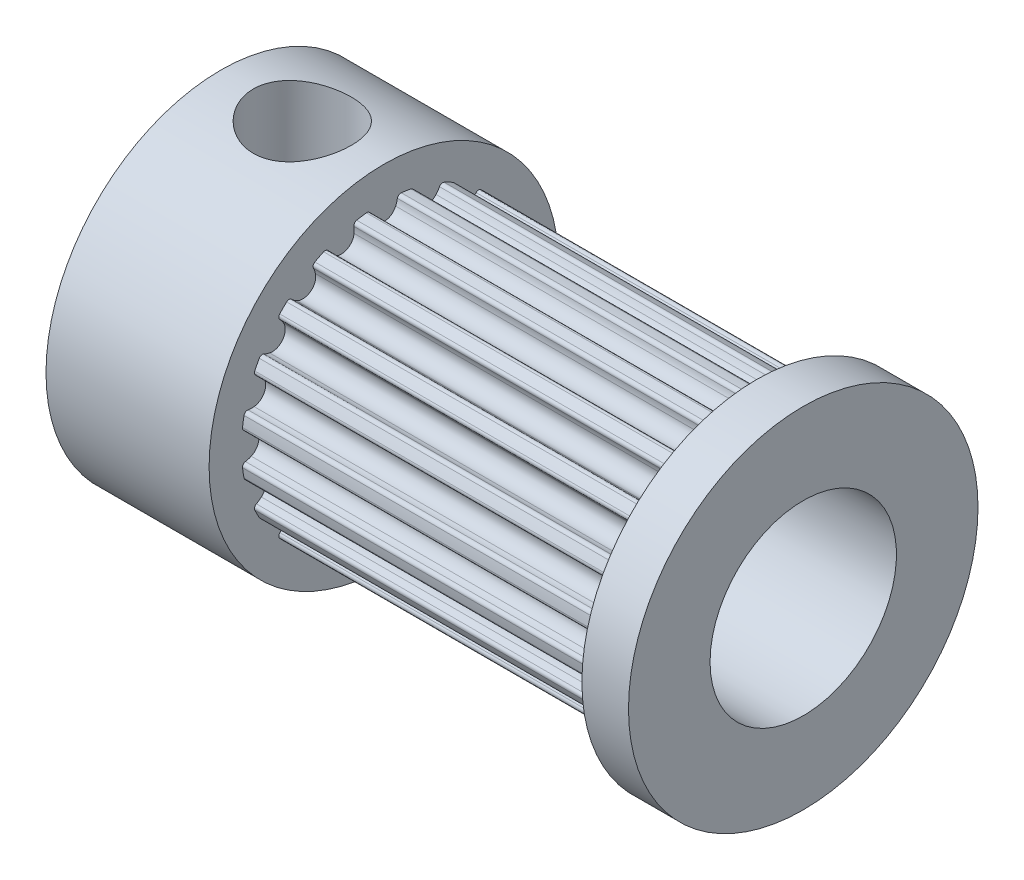
from build123d import *

# Parameters (mm, degrees)
SKETCH1_R           = 7.5
BOSS_EXTRUDE1_DEPTH = 7
BOSS_EXTRUDE2_DEPTH = 16
FILLET1_R           = 0.15
CIRPATTERN1_START   = 7
CIRPATTERN1_DEPTH   = 16
SKETCH3_R           = 7.5
BOSS_EXTRUDE3_DEPTH = 2
SKETCH4_R           = 4
CUT_EXTRUDE1_DEPTH  = 28.156951283
SKETCH5_R           = 2.1
CUT_EXTRUDE2_DEPTH  = 28.156951283
CIRPATTERN2_COUNT   = 2
CIRPATTERN2_ANGLE   = 90


# Read off the part's stored shape, not the designer's step: CirPattern1
with BuildPart() as part:
    # Sketch1 → Boss-Extrude1 (new body)
    with BuildSketch(Plane(origin=(0, 0, 0), x_dir=(0, 0, -1), z_dir=(1, 0, 0))):
        Circle(SKETCH1_R)
    extrude(amount=BOSS_EXTRUDE1_DEPTH)

    # Sketch2 → Boss-Extrude2 (add)
    with BuildSketch(Plane(origin=(7, 0, 0), x_dir=(0, 0, -1), z_dir=(1, 0, 0))):
        with BuildLine():
            ThreePointArc((-0.593569217, 6.083307806), (0, -6.1121975), (0.593569217, 6.083307806))
            ThreePointArc((0.593569217, 6.083307806), (0.570080241, 5.882675498), (0.506749498, 5.690857168))
            ThreePointArc((0.506749498, 5.690857168), (0, 5.3621975), (-0.506749498, 5.690857168))
            ThreePointArc((-0.506749498, 5.690857168), (-0.570080241, 5.882675498), (-0.593569217, 6.083307806))
        make_face()
    extrude(amount=BOSS_EXTRUDE2_DEPTH)

    # Fillet1
    fillet1_edges = [part.edges().sort_by_distance(p)[0] for p in [
        (15, 6.083307806, -0.593569217),
        (15, 6.083307806, 0.593569217),
    ]]
    fillet(fillet1_edges, radius=FILLET1_R)

    # CirPattern1 outline → CirPattern1 (cut)
    with BuildSketch(Plane.YZ.offset(CIRPATTERN1_START)):
        with BuildLine():
            ThreePointArc((6.000431601, 1.163520043), (5.813045262, 1.888772901), (5.53835106, 2.585657714))
            ThreePointArc((5.53835106, 2.585657714), (5.544301896, 2.473484624), (5.470691795, 2.38863318))
            ThreePointArc((5.470691795, 2.38863318), (5.358358343, 2.32162051), (5.255732586, 2.24051899))
            ThreePointArc((5.255732586, 2.24051899), (5.099752874, 1.657010155), (5.568921, 1.276624165))
            ThreePointArc((5.568921, 1.276624165), (5.699617259, 1.271333563), (5.82988599, 1.283147121))
            ThreePointArc((5.82988599, 1.283147121), (5.93931224, 1.257767792), (6.000431601, 1.163520043))
        make_face()
        with BuildLine():
            ThreePointArc((5.347202108, 2.960808657), (4.944871651, 3.59265955), (4.46827269, 4.170551216))
            ThreePointArc((4.46827269, 4.170551216), (4.508595662, 4.065707178), (4.464808835, 3.962261887))
            ThreePointArc((4.464808835, 3.962261887), (4.378681426, 3.863816105), (4.30614028, 3.754970872))
            ThreePointArc((4.30614028, 3.754970872), (4.338108905, 3.15182061), (4.901860043, 2.93503296))
            ThreePointArc((4.901860043, 2.93503296), (5.027794458, 2.970388664), (5.148036794, 3.021879277))
            ThreePointArc((5.148036794, 3.021879277), (5.259949985, 3.031556672), (5.347202108, 2.960808657))
        make_face()
        with BuildLine():
            ThreePointArc((4.170551216, 4.46827269), (3.59265955, 4.944871651), (2.960808657, 5.347202107))
            ThreePointArc((2.960808657, 5.347202107), (3.031556672, 5.259949985), (3.021879277, 5.148036794))
            ThreePointArc((3.021879277, 5.148036794), (2.970388664, 5.027794458), (2.93503296, 4.901860043))
            ThreePointArc((2.93503296, 4.901860043), (3.15182061, 4.338108905), (3.754970872, 4.30614028))
            ThreePointArc((3.754970872, 4.30614028), (3.863816105, 4.378681426), (3.962261887, 4.464808835))
            ThreePointArc((3.962261887, 4.464808835), (4.065707178, 4.508595662), (4.170551216, 4.46827269))
        make_face()
        with BuildLine():
            ThreePointArc((2.585657714, 5.53835106), (1.888772901, 5.813045261), (1.163520043, 6.0004316))
            ThreePointArc((1.163520043, 6.0004316), (1.257767792, 5.93931224), (1.283147121, 5.82988599))
            ThreePointArc((1.283147121, 5.82988599), (1.271333563, 5.699617259), (1.276624165, 5.568921))
            ThreePointArc((1.276624165, 5.568921), (1.657010155, 5.099752874), (2.24051899, 5.255732586))
            ThreePointArc((2.24051899, 5.255732586), (2.32162051, 5.358358343), (2.38863318, 5.470691795))
            ThreePointArc((2.38863318, 5.470691795), (2.473484624, 5.544301896), (2.585657714, 5.53835106))
        make_face()
        with BuildLine():
            ThreePointArc((0.747662019, 6.066297041), (0, 6.1121975), (-0.747662019, 6.066297041))
            ThreePointArc((-0.747662019, 6.066297041), (-0.639140162, 6.037293231), (-0.581188416, 5.941065327))
            ThreePointArc((-0.581188416, 5.941065327), (-0.552168525, 5.813521811), (-0.506749498, 5.690857168))
            ThreePointArc((-0.506749498, 5.690857168), (0, 5.3621975), (0.506749498, 5.690857168))
            ThreePointArc((0.506749498, 5.690857168), (0.552168525, 5.813521811), (0.581188416, 5.941065327))
            ThreePointArc((0.581188416, 5.941065327), (0.639140162, 6.037293231), (0.747662019, 6.066297041))
        make_face()
        with BuildLine():
            ThreePointArc((-1.163520043, 6.0004316), (-1.888772901, 5.813045261), (-2.585657714, 5.53835106))
            ThreePointArc((-2.585657714, 5.53835106), (-2.473484624, 5.544301896), (-2.38863318, 5.470691795))
            ThreePointArc((-2.38863318, 5.470691795), (-2.32162051, 5.358358343), (-2.24051899, 5.255732586))
            ThreePointArc((-2.24051899, 5.255732586), (-1.657010155, 5.099752874), (-1.276624165, 5.568921))
            ThreePointArc((-1.276624165, 5.568921), (-1.271333563, 5.699617259), (-1.283147121, 5.82988599))
            ThreePointArc((-1.283147121, 5.82988599), (-1.257767792, 5.93931224), (-1.163520043, 6.0004316))
        make_face()
        with BuildLine():
            ThreePointArc((-2.960808657, 5.347202107), (-3.59265955, 4.94487165), (-4.170551216, 4.46827269))
            ThreePointArc((-4.170551216, 4.46827269), (-4.065707178, 4.508595662), (-3.962261887, 4.464808835))
            ThreePointArc((-3.962261887, 4.464808835), (-3.863816105, 4.378681426), (-3.754970872, 4.30614028))
            ThreePointArc((-3.754970872, 4.30614028), (-3.15182061, 4.338108905), (-2.93503296, 4.901860043))
            ThreePointArc((-2.93503296, 4.901860043), (-2.970388664, 5.027794458), (-3.021879277, 5.148036794))
            ThreePointArc((-3.021879277, 5.148036794), (-3.031556672, 5.259949985), (-2.960808657, 5.347202107))
        make_face()
        with BuildLine():
            ThreePointArc((-4.46827269, 4.170551216), (-4.94487165, 3.59265955), (-5.347202107, 2.960808657))
            ThreePointArc((-5.347202107, 2.960808657), (-5.259949985, 3.031556672), (-5.148036794, 3.021879277))
            ThreePointArc((-5.148036794, 3.021879277), (-5.027794458, 2.970388664), (-4.901860043, 2.93503296))
            ThreePointArc((-4.901860043, 2.93503296), (-4.338108905, 3.15182061), (-4.30614028, 3.754970872))
            ThreePointArc((-4.30614028, 3.754970872), (-4.378681426, 3.863816105), (-4.464808835, 3.962261887))
            ThreePointArc((-4.464808835, 3.962261887), (-4.508595662, 4.065707178), (-4.46827269, 4.170551216))
        make_face()
        with BuildLine():
            ThreePointArc((-5.53835106, 2.585657714), (-5.813045261, 1.888772901), (-6.0004316, 1.163520043))
            ThreePointArc((-6.0004316, 1.163520043), (-5.93931224, 1.257767792), (-5.82988599, 1.283147121))
            ThreePointArc((-5.82988599, 1.283147121), (-5.699617259, 1.271333563), (-5.568921, 1.276624165))
            ThreePointArc((-5.568921, 1.276624165), (-5.099752874, 1.657010155), (-5.255732586, 2.24051899))
            ThreePointArc((-5.255732586, 2.24051899), (-5.358358343, 2.32162051), (-5.470691795, 2.38863318))
            ThreePointArc((-5.470691795, 2.38863318), (-5.544301896, 2.473484624), (-5.53835106, 2.585657714))
        make_face()
        with BuildLine():
            ThreePointArc((-6.066297041, 0.747662019), (-6.1121975, 0), (-6.066297041, -0.747662019))
            ThreePointArc((-6.066297041, -0.747662019), (-6.037293231, -0.639140162), (-5.941065327, -0.581188416))
            ThreePointArc((-5.941065327, -0.581188416), (-5.813521811, -0.552168525), (-5.690857168, -0.506749498))
            ThreePointArc((-5.690857168, -0.506749498), (-5.3621975, 0), (-5.690857168, 0.506749498))
            ThreePointArc((-5.690857168, 0.506749498), (-5.813521811, 0.552168525), (-5.941065327, 0.581188416))
            ThreePointArc((-5.941065327, 0.581188416), (-6.037293231, 0.639140162), (-6.066297041, 0.747662019))
        make_face()
        with BuildLine():
            ThreePointArc((-6.0004316, -1.163520043), (-5.813045261, -1.888772901), (-5.53835106, -2.585657714))
            ThreePointArc((-5.53835106, -2.585657714), (-5.544301896, -2.473484624), (-5.470691795, -2.38863318))
            ThreePointArc((-5.470691795, -2.38863318), (-5.358358343, -2.32162051), (-5.255732586, -2.24051899))
            ThreePointArc((-5.255732586, -2.24051899), (-5.099752874, -1.657010155), (-5.568921, -1.276624165))
            ThreePointArc((-5.568921, -1.276624165), (-5.699617259, -1.271333563), (-5.82988599, -1.283147121))
            ThreePointArc((-5.82988599, -1.283147121), (-5.93931224, -1.257767792), (-6.0004316, -1.163520043))
        make_face()
        with BuildLine():
            ThreePointArc((-5.347202107, -2.960808657), (-4.94487165, -3.59265955), (-4.46827269, -4.170551216))
            ThreePointArc((-4.46827269, -4.170551216), (-4.508595662, -4.065707178), (-4.464808835, -3.962261887))
            ThreePointArc((-4.464808835, -3.962261887), (-4.378681426, -3.863816105), (-4.30614028, -3.754970872))
            ThreePointArc((-4.30614028, -3.754970872), (-4.338108905, -3.15182061), (-4.901860043, -2.93503296))
            ThreePointArc((-4.901860043, -2.93503296), (-5.027794458, -2.970388664), (-5.148036794, -3.021879277))
            ThreePointArc((-5.148036794, -3.021879277), (-5.259949985, -3.031556672), (-5.347202107, -2.960808657))
        make_face()
        with BuildLine():
            ThreePointArc((-4.170551216, -4.46827269), (-3.59265955, -4.94487165), (-2.960808657, -5.347202107))
            ThreePointArc((-2.960808657, -5.347202107), (-3.031556672, -5.259949985), (-3.021879277, -5.148036794))
            ThreePointArc((-3.021879277, -5.148036794), (-2.970388664, -5.027794458), (-2.93503296, -4.901860043))
            ThreePointArc((-2.93503296, -4.901860043), (-3.15182061, -4.338108905), (-3.754970872, -4.30614028))
            ThreePointArc((-3.754970872, -4.30614028), (-3.863816105, -4.378681426), (-3.962261887, -4.464808835))
            ThreePointArc((-3.962261887, -4.464808835), (-4.065707178, -4.508595662), (-4.170551216, -4.46827269))
        make_face()
        with BuildLine():
            ThreePointArc((-2.585657714, -5.53835106), (-1.888772901, -5.813045261), (-1.163520043, -6.0004316))
            ThreePointArc((-1.163520043, -6.0004316), (-1.257767792, -5.93931224), (-1.283147121, -5.82988599))
            ThreePointArc((-1.283147121, -5.82988599), (-1.271333563, -5.699617259), (-1.276624165, -5.568921))
            ThreePointArc((-1.276624165, -5.568921), (-1.657010155, -5.099752874), (-2.24051899, -5.255732586))
            ThreePointArc((-2.24051899, -5.255732586), (-2.32162051, -5.358358343), (-2.38863318, -5.470691795))
            ThreePointArc((-2.38863318, -5.470691795), (-2.473484624, -5.544301896), (-2.585657714, -5.53835106))
        make_face()
        with BuildLine():
            ThreePointArc((-0.747662019, -6.066297041), (0, -6.1121975), (0.747662019, -6.066297041))
            ThreePointArc((0.747662019, -6.066297041), (0.639140162, -6.037293231), (0.581188416, -5.941065327))
            ThreePointArc((0.581188416, -5.941065327), (0.552168525, -5.813521811), (0.506749498, -5.690857168))
            ThreePointArc((0.506749498, -5.690857168), (0, -5.3621975), (-0.506749498, -5.690857168))
            ThreePointArc((-0.506749498, -5.690857168), (-0.552168525, -5.813521811), (-0.581188416, -5.941065327))
            ThreePointArc((-0.581188416, -5.941065327), (-0.639140162, -6.037293231), (-0.747662019, -6.066297041))
        make_face()
        with BuildLine():
            ThreePointArc((1.163520043, -6.0004316), (1.888772901, -5.813045261), (2.585657714, -5.53835106))
            ThreePointArc((2.585657714, -5.53835106), (2.473484624, -5.544301896), (2.38863318, -5.470691795))
            ThreePointArc((2.38863318, -5.470691795), (2.32162051, -5.358358343), (2.24051899, -5.255732586))
            ThreePointArc((2.24051899, -5.255732586), (1.657010155, -5.099752874), (1.276624165, -5.568921))
            ThreePointArc((1.276624165, -5.568921), (1.271333563, -5.699617259), (1.283147121, -5.82988599))
            ThreePointArc((1.283147121, -5.82988599), (1.257767792, -5.93931224), (1.163520043, -6.0004316))
        make_face()
        with BuildLine():
            ThreePointArc((2.960808657, -5.347202107), (3.59265955, -4.944871651), (4.170551216, -4.46827269))
            ThreePointArc((4.170551216, -4.46827269), (4.065707178, -4.508595662), (3.962261887, -4.464808835))
            ThreePointArc((3.962261887, -4.464808835), (3.863816105, -4.378681426), (3.754970872, -4.30614028))
            ThreePointArc((3.754970872, -4.30614028), (3.15182061, -4.338108905), (2.93503296, -4.901860043))
            ThreePointArc((2.93503296, -4.901860043), (2.970388664, -5.027794458), (3.021879277, -5.148036794))
            ThreePointArc((3.021879277, -5.148036794), (3.031556672, -5.259949985), (2.960808657, -5.347202107))
        make_face()
        with BuildLine():
            ThreePointArc((4.46827269, -4.170551216), (4.944871651, -3.59265955), (5.347202108, -2.960808657))
            ThreePointArc((5.347202108, -2.960808657), (5.259949985, -3.031556672), (5.148036794, -3.021879277))
            ThreePointArc((5.148036794, -3.021879277), (5.027794458, -2.970388664), (4.901860043, -2.93503296))
            ThreePointArc((4.901860043, -2.93503296), (4.338108905, -3.15182061), (4.30614028, -3.754970872))
            ThreePointArc((4.30614028, -3.754970872), (4.378681426, -3.863816105), (4.464808835, -3.962261887))
            ThreePointArc((4.464808835, -3.962261887), (4.508595662, -4.065707178), (4.46827269, -4.170551216))
        make_face()
        with BuildLine():
            ThreePointArc((6.0004316, -1.163520043), (5.93931224, -1.257767792), (5.82988599, -1.283147121))
            ThreePointArc((5.82988599, -1.283147121), (5.699617259, -1.271333563), (5.568921, -1.276624165))
            ThreePointArc((5.568921, -1.276624165), (5.099752874, -1.657010155), (5.255732586, -2.24051899))
            ThreePointArc((5.255732586, -2.24051899), (5.358358343, -2.32162051), (5.470691795, -2.38863318))
            ThreePointArc((5.470691795, -2.38863318), (5.544301896, -2.473484624), (5.53835106, -2.585657714))
            ThreePointArc((5.53835106, -2.585657714), (5.813045262, -1.888772901), (6.0004316, -1.163520043))
        make_face()
    extrude(amount=CIRPATTERN1_DEPTH, mode=Mode.SUBTRACT)

    # Sketch3 → Boss-Extrude3 (add)
    with BuildSketch(Plane(origin=(23, 0, 0), x_dir=(0, 0, -1), z_dir=(1, 0, 0))):
        Circle(SKETCH3_R)
    extrude(amount=BOSS_EXTRUDE3_DEPTH)

    # Sketch4 → Cut-Extrude1 (cut, through all)
    with BuildSketch(Plane.ZY):
        Circle(SKETCH4_R)
    extrude(amount=-CUT_EXTRUDE1_DEPTH, mode=Mode.SUBTRACT)

    # Sketch5 → Cut-Extrude2 (cut, through all)
    with BuildSketch(Plane.XY):
        with Locations((3.5, 0)):
            Circle(SKETCH5_R)
    cut_extrude2 = extrude(amount=-CUT_EXTRUDE2_DEPTH, mode=Mode.SUBTRACT)

    # CirPattern2: Cut-Extrude2 ×2 about axis
    cirpattern2_axis = Axis((0, 0, 0), (1, 0, 0))
    for i in range(1, CIRPATTERN2_COUNT):
        add(cut_extrude2.rotate(cirpattern2_axis, i * CIRPATTERN2_ANGLE / (CIRPATTERN2_COUNT - 1)), mode=Mode.SUBTRACT)


solid = part.part
